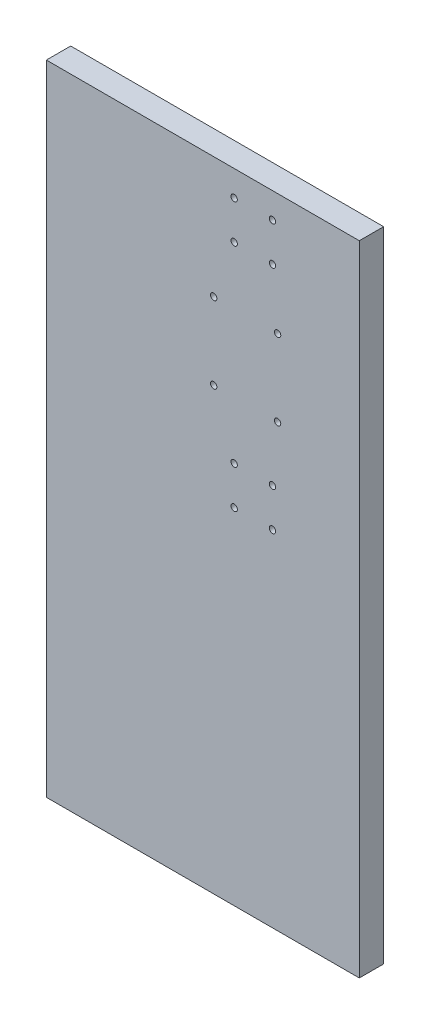
from build123d import *

# Parameters (mm, degrees)
SKETCH1_W                 = 245.05
SKETCH1_H                 = 500
BOSS_EXTRUDE1_DEPTH       = 19.05
F_5_0MM_DOWEL_HOLE1_D     = 5
F_5_0MM_DOWEL_HOLE1_DEPTH = 28.497848452
F_5_0MM_DOWEL_HOLE1_TIP   = 1.502151548


with BuildPart() as part:
    # Sketch1 → Boss-Extrude1 (new body)
    with BuildSketch(Plane.XY):
        with Locations((-122.525, 0)):
            Rectangle(SKETCH1_W, SKETCH1_H)
    extrude(amount=BOSS_EXTRUDE1_DEPTH)

    # Ø5.0mm Dowel Hole1
    with Locations(Plane.XY.offset(19.05)):
        with Locations((-68, 20), (-98, 20), (-68, 50), (-98, 50), (-64, 95), (-114, 95), (-64, 155), (-114, 155), (-68, 200), (-98, 200), (-68, 230), (-98, 230)):
            Hole(F_5_0MM_DOWEL_HOLE1_D / 2, depth=F_5_0MM_DOWEL_HOLE1_DEPTH)
            with Locations((0, 0, -(F_5_0MM_DOWEL_HOLE1_DEPTH + F_5_0MM_DOWEL_HOLE1_TIP / 2))):  # 118° drill point
                Cone(0, F_5_0MM_DOWEL_HOLE1_D / 2, F_5_0MM_DOWEL_HOLE1_TIP, mode=Mode.SUBTRACT)


solid = part.part
